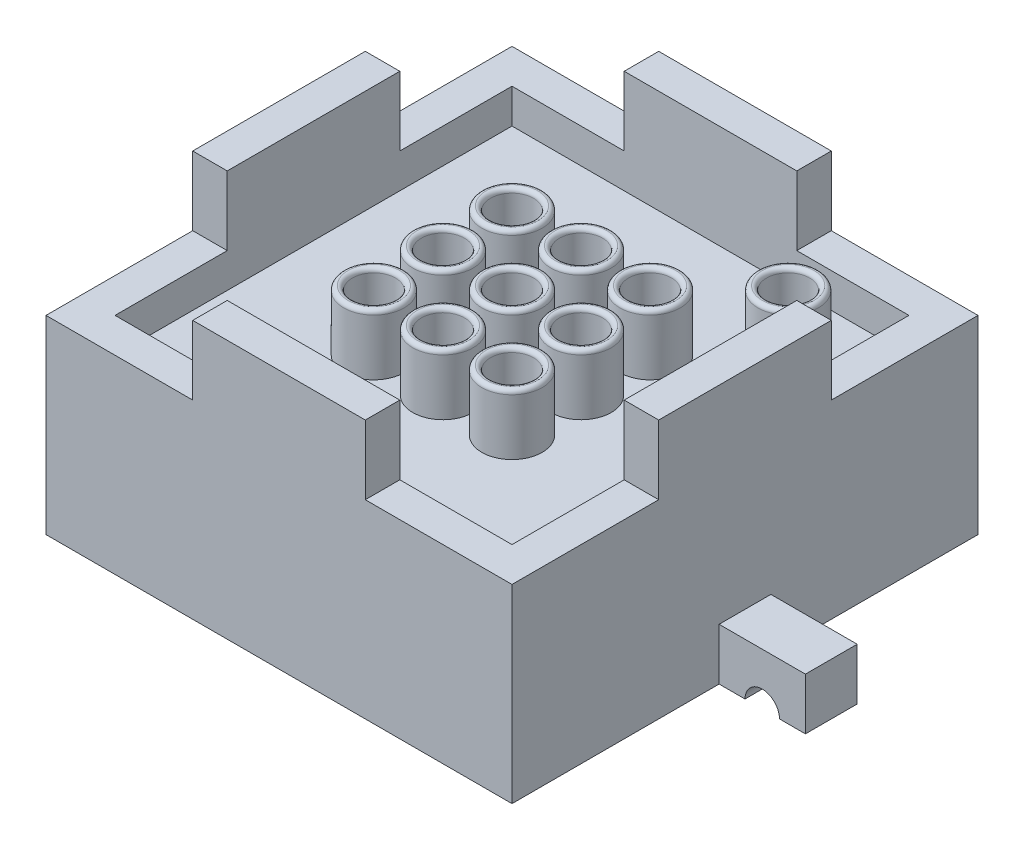
from build123d import *

# Parameters (mm, degrees)
SKETCH1_W              = 27
SKETCH1_H              = 27
SKETCH1_W_2            = 23
SKETCH1_H_2            = 23
BOSS_EXTRUDE1_DEPTH    = 2
SKETCH2_W              = 27
SKETCH2_H              = 27
BOSS_EXTRUDE2_DEPTH    = 2
SKETCH3_W              = 27
SKETCH3_H              = 27
SKETCH3_W_2            = 23
SKETCH3_H_2            = 23
BOSS_EXTRUDE3_DEPTH    = 5
SKETCH6_R              = 1.75
BOSS_EXTRUDE5_DEPTH    = 3.5
CUT_EXTRUDE2_REACH     = 23.789
SKETCH7_R              = 1.25
FILLET1_R              = 0.25
LPATTERN3_COUNT        = 5
LPATTERN3_PITCH        = 4
LPATTERN3_COUNT_DIR2   = 5
LPATTERN3_PITCH_DIR2   = 4
FILLET1_OF_LPATTERN3_R = 0.25
SKETCH11_R             = 0.75
BOSS_EXTRUDE8_DEPTH    = 5
LPATTERN2_COUNT        = 6
LPATTERN2_PITCH        = 4
LPATTERN2_COUNT_DIR2   = 6
LPATTERN2_PITCH_DIR2   = 4
SKETCH8_W              = 27
SKETCH8_H              = 27
BOSS_EXTRUDE6_DEPTH    = 2
SKETCH9_R              = 4.25
CUT_EXTRUDE3_DEPTH     = 7
SKETCH10_W             = 2
SKETCH10_H             = 10
BOSS_EXTRUDE7_DEPTH    = 4
CIRPATTERN2_COUNT      = 4
SKETCH12_W             = 3
SKETCH12_H             = 3
BOSS_EXTRUDE9_DEPTH    = 5
CIRPATTERN1_COUNT      = 2
CUT_EXTRUDE4_REACH     = 27.461


with BuildPart() as part:
    # Sketch1 → Boss-Extrude1 (new body)
    with BuildSketch(Plane(origin=(0, 0, 0), x_dir=(1, 0, 0), z_dir=(0, 1, 0))):
        Rectangle(SKETCH1_W, SKETCH1_H)
        Rectangle(SKETCH1_W_2, SKETCH1_H_2, mode=Mode.SUBTRACT)
    extrude(amount=BOSS_EXTRUDE1_DEPTH)

    # Sketch2 → Boss-Extrude2 (add)
    with BuildSketch(Plane.XZ):
        Rectangle(SKETCH2_W, SKETCH2_H)
    extrude(amount=BOSS_EXTRUDE2_DEPTH)

    # Sketch3 → Boss-Extrude3 (add)
    with BuildSketch(Plane.XZ.offset(2)):
        Rectangle(SKETCH3_W, SKETCH3_H)
        Rectangle(SKETCH3_W_2, SKETCH3_H_2, mode=Mode.SUBTRACT)
    extrude(amount=BOSS_EXTRUDE3_DEPTH)

    # Sketch6 → Boss-Extrude5 (add)
    with BuildSketch(Plane(origin=(0, 0, 0), x_dir=(1, 0, 0), z_dir=(0, 1, 0))):
        with Locations(Location((8, 8, 0), (0, 0, 90))):
            Circle(SKETCH6_R)
    boss_extrude5 = extrude(amount=BOSS_EXTRUDE5_DEPTH)

    # Sketch7 → Cut-Extrude2 (cut, up to next)
    with BuildSketch(Plane(origin=(0, 3.5, 0), x_dir=(1, 0, 0), z_dir=(0, 1, 0)), mode=Mode.PRIVATE) as cut_extrude2_sk1:
        with Locations(Location((8, 8, 0), (0, 0, 270))):
            Circle(SKETCH7_R)
    cut_extrude2_tool1 = extrude(cut_extrude2_sk1.sketch, amount=-CUT_EXTRUDE2_REACH, mode=Mode.PRIVATE) & part.part
    cut_extrude2 = cut_extrude2_tool1.solids().sort_by_distance((8, 3.5, -8))[0]
    add(cut_extrude2, mode=Mode.SUBTRACT)

    # Fillet1
    fillet1_edges = [part.edges().sort_by_distance(p)[0] for p in [
        (8, 3.5, -6.25),
        (8, 3.5, -9.25),
    ]]
    fillet(fillet1_edges, radius=FILLET1_R - 0.0001)  # a hair under: the kernel refuses the full size

    # LPattern3: Boss-Extrude5, Cut-Extrude2 5 × 5, 15 skipped
    with Locations(*[(-j * LPATTERN3_PITCH_DIR2, 0, i * LPATTERN3_PITCH) for i in range(LPATTERN3_COUNT) for j in range(LPATTERN3_COUNT_DIR2) if (i, j) not in ((0, 0), (0, 1), (0, 2), (0, 3), (0, 4), (1, 0), (1, 4), (2, 0), (2, 4), (3, 0), (3, 4), (4, 0), (4, 1), (4, 2), (4, 3), (4, 4))]):
        add(boss_extrude5)
        add(cut_extrude2, mode=Mode.SUBTRACT)

    # Fillet1 of LPattern3
    fillet1_of_lpattern3_edges = [part.edges().sort_by_distance(p)[0] for p in [
        (4, 3.5, -2.25),
        (4, 3.5, -5.25),
        (0, 3.5, -2.25),
        (0, 3.5, -5.25),
        (-4, 3.5, -2.25),
        (-4, 3.5, -5.25),
        (4, 3.5, 1.75),
        (4, 3.5, -1.25),
        (0, 3.5, 1.75),
        (0, 3.5, -1.25),
        (-4, 3.5, 1.75),
        (-4, 3.5, -1.25),
        (4, 3.5, 5.75),
        (4, 3.5, 2.75),
        (0, 3.5, 5.75),
        (0, 3.5, 2.75),
        (-4, 3.5, 5.75),
        (-4, 3.5, 2.75),
    ]]
    fillet(fillet1_of_lpattern3_edges, radius=FILLET1_OF_LPATTERN3_R - 0.0001)  # a hair under: the kernel refuses the full size

    # Sketch11 → Boss-Extrude8 (add)
    with BuildSketch(Plane.XZ.offset(2)):
        with Locations(Location((-9.9, 9.9, 0), (0, 0, 90))):
            Circle(SKETCH11_R)
    boss_extrude8 = extrude(amount=BOSS_EXTRUDE8_DEPTH)

    # LPattern2: Boss-Extrude8 6 × 6
    with Locations(*[(i * LPATTERN2_PITCH, 0, -j * LPATTERN2_PITCH_DIR2) for i in range(LPATTERN2_COUNT) for j in range(LPATTERN2_COUNT_DIR2) if (i, j) != (0, 0)]):
        add(boss_extrude8)

    # Sketch8 → Boss-Extrude6 (add)
    with BuildSketch(Plane.XZ.offset(7)):
        Rectangle(SKETCH8_W, SKETCH8_H)
    extrude(amount=BOSS_EXTRUDE6_DEPTH)

    # Sketch9 → Cut-Extrude3 (cut)
    with BuildSketch(Plane.XZ.offset(9)):
        with Locations(Location((0, 0, 0), (0, 0, 270))):
            Circle(SKETCH9_R)
    extrude(amount=-CUT_EXTRUDE3_DEPTH, mode=Mode.SUBTRACT)

    # Sketch10 → Boss-Extrude7 (add)
    with BuildSketch(Plane(origin=(0, 2, 0), x_dir=(1, 0, 0), z_dir=(0, 1, 0))):
        with Locations((-12.5, 0)):
            Rectangle(SKETCH10_W, SKETCH10_H)
    boss_extrude7 = extrude(amount=BOSS_EXTRUDE7_DEPTH)

    # CirPattern2: Boss-Extrude7 ×4 about axis
    cirpattern2_axis = Axis((0, 0, 0), (0, 1, 0))
    for i in range(1, CIRPATTERN2_COUNT):
        add(boss_extrude7.rotate(cirpattern2_axis, i * 360 / CIRPATTERN2_COUNT))

    # Sketch12 → Boss-Extrude9 (add)
    with BuildSketch(Plane.ZY.offset(13.5)):
        with Locations((0, -7.5)):
            Rectangle(SKETCH12_W, SKETCH12_H)
    boss_extrude9 = extrude(amount=BOSS_EXTRUDE9_DEPTH)

    # CirPattern1: Boss-Extrude9 ×2 about axis
    cirpattern1_axis = Axis((0, 0, 0), (0, 1, 0))
    for i in range(1, CIRPATTERN1_COUNT):
        add(boss_extrude9.rotate(cirpattern1_axis, i * 360 / CIRPATTERN1_COUNT))

    # Sketch13 → Cut-Extrude4 (cut, up to next)
    with BuildSketch(Plane.XY.offset(1.5), mode=Mode.PRIVATE) as cut_extrude4_sk1:
        with BuildLine():
            Line((15, -9), (17, -9))
            ThreePointArc((17, -9), (16, -8), (15, -9))
        make_face()
    cut_extrude4_tool1 = extrude(cut_extrude4_sk1.sketch, amount=-CUT_EXTRUDE4_REACH, mode=Mode.PRIVATE) & part.part
    # Sketch13 → Cut-Extrude4 (cut, up to next)
    with BuildSketch(Plane.XY.offset(1.5), mode=Mode.PRIVATE) as cut_extrude4_sk2:
        with BuildLine():
            Line((-17, -9), (-15, -9))
            ThreePointArc((-15, -9), (-16, -8), (-17, -9))
        make_face()
    cut_extrude4_tool2 = extrude(cut_extrude4_sk2.sketch, amount=-CUT_EXTRUDE4_REACH, mode=Mode.PRIVATE) & part.part
    add(cut_extrude4_tool1.solids().sort_by_distance((16, -8.575587, 1.5))[0], mode=Mode.SUBTRACT)
    add(cut_extrude4_tool2.solids().sort_by_distance((-16, -8.575587, 1.5))[0], mode=Mode.SUBTRACT)


solid = part.part
